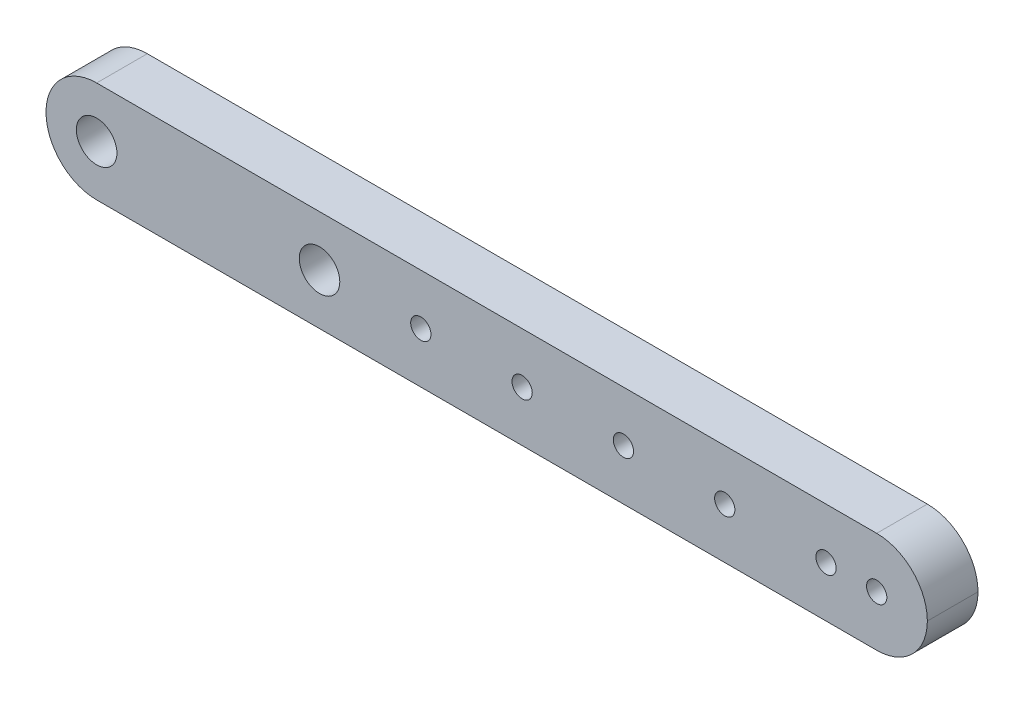
from build123d import *

# Parameters (mm, degrees)
ESQUISSE1_R        = 4
ESQUISSE1_R_2      = 2
BOSS_EXTRU_1_DEPTH = 10
CONG_1_R           = 10


with BuildPart() as part:
    # Esquisse1 → Boss.-Extru.1 (new body)
    with BuildSketch(Plane.XY):
        Polygon((0, 20), (0, 0), (60, 0), (154, 0), (174, 0), (174, 20), (154, 20), (60, 20), align=None)
        with Locations((10, 10)):
            Circle(ESQUISSE1_R, mode=Mode.SUBTRACT)
        with Locations((54, 10)):
            Circle(ESQUISSE1_R, mode=Mode.SUBTRACT)
        with Locations((154, 10)):
            Circle(ESQUISSE1_R_2, mode=Mode.SUBTRACT)
        with Locations((164, 10)):
            Circle(ESQUISSE1_R_2, mode=Mode.SUBTRACT)
        with Locations((74, 10)):
            Circle(ESQUISSE1_R_2, mode=Mode.SUBTRACT)
        with Locations((94, 10)):
            Circle(ESQUISSE1_R_2, mode=Mode.SUBTRACT)
        with Locations((114, 10)):
            Circle(ESQUISSE1_R_2, mode=Mode.SUBTRACT)
        with Locations((134, 10)):
            Circle(ESQUISSE1_R_2, mode=Mode.SUBTRACT)
    extrude(amount=BOSS_EXTRU_1_DEPTH)

    # Congé1
    cong_1_edges = [part.edges().sort_by_distance(p)[0] for p in [
        (0, 0, 5),
        (0, 20, 5),
        (174, 0, 5),
        (174, 20, 5),
    ]]
    fillet(cong_1_edges, radius=CONG_1_R - 0.0001)  # a hair under: the kernel refuses the full size


solid = part.part
